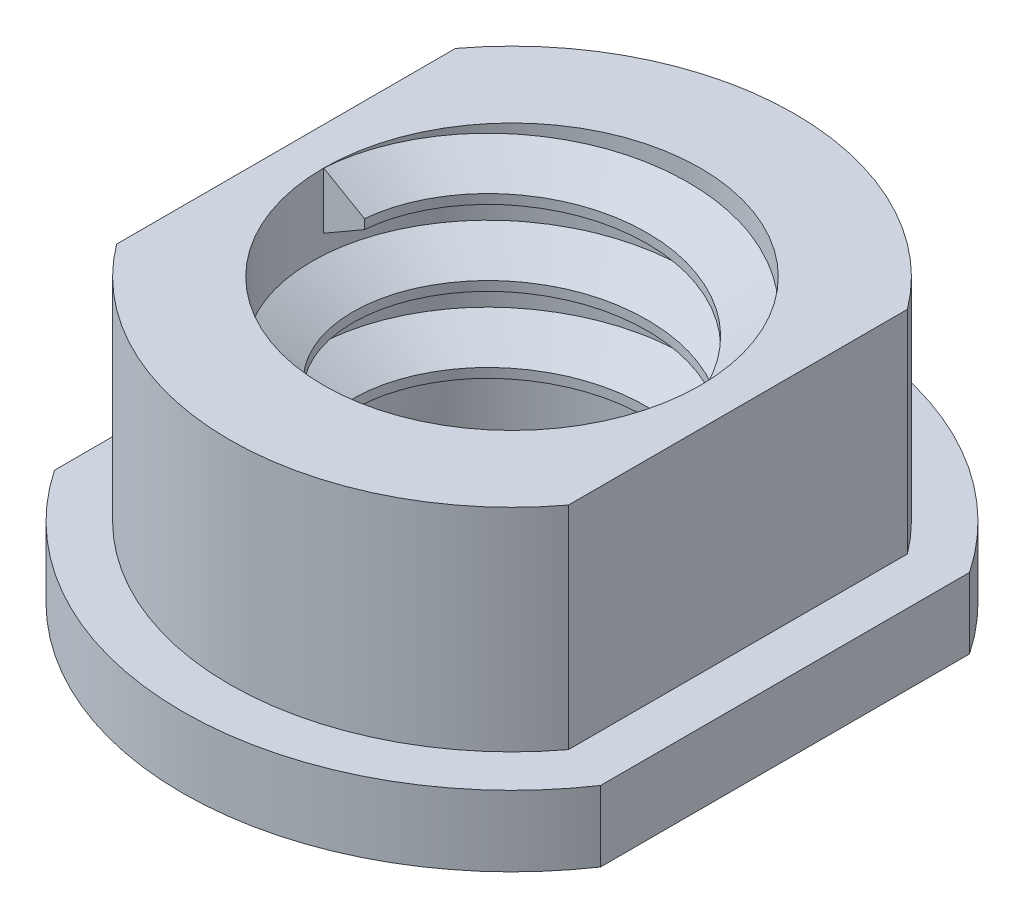
from build123d import *

# Parameters (mm, degrees)
BOSS_EXTRUDE1_DEPTH = 1.875
BOSS_EXTRUDE2_DEPTH = 11.25
SKETCH4_R           = 10
CUT_EXTRUDE1_DEPTH  = 28.230497608
THREAD1_PITCH       = 4


with BuildPart() as part:
    # Sketch1 → Boss-Extrude1 (new, symmetric)
    with BuildSketch(Plane(origin=(0, 0, 0), x_dir=(1, 0, 0), z_dir=(0, 1, 0))):
        with BuildLine():
            Line((-14.5, 9.797958971), (-14.5, -9.797958971))
            ThreePointArc((-14.5, -9.797958971), (0, -17.5), (14.5, -9.797958971))
            Line((14.5, -9.797958971), (14.5, 9.797958971))
            ThreePointArc((14.5, 9.797958971), (0, 17.5), (-14.5, 9.797958971))
        make_face()
    extrude(amount=BOSS_EXTRUDE1_DEPTH, both=True)

    # Sketch2 → Boss-Extrude2 (add)
    with BuildSketch(Plane(origin=(0, 1.875, 0), x_dir=(1, 0, 0), z_dir=(0, 1, 0))):
        with BuildLine():
            Line((12, 9), (12, -9))
            ThreePointArc((12, -9), (0, -15), (-12, -9))
            Line((-12, -9), (-12, 9))
            ThreePointArc((-12, 9), (0, 15), (12, 9))
        make_face()
    extrude(amount=BOSS_EXTRUDE2_DEPTH)

    # Sketch4 → Cut-Extrude1 (cut, through all)
    with BuildSketch(Plane(origin=(0, 13.125, 0), x_dir=(1, 0, 0), z_dir=(0, 1, 0))):
        with Locations(Location((0, 0, 0), (0, 0, 270))):
            Circle(SKETCH4_R)
    extrude(amount=-CUT_EXTRUDE1_DEPTH, mode=Mode.SUBTRACT)

    # Thread1: arcs per turn and ends read off the stored shape
    # Thread1: the profile of Thread Profile1 profile screwed along a right-hand helix through 3 turns, 12 arcs to a turn; built about Z, then put on its axis
    thread1_z = Axis((0, 0, 0), (0, 0, 1))
    thread1_corners = [(10.0003, 0, -0.000173205), (7.8349365, 0, 1.249999995), (7.8349365, 0, 1.749999995), (10.0003, 0, 3.000173194)]
    with BuildLine(mode=Mode.PRIVATE) as thread1_profile:
        Line(thread1_corners[0], thread1_corners[1])
        Line(thread1_corners[1], thread1_corners[2])
        Line(thread1_corners[2], thread1_corners[3])
        Line(thread1_corners[3], thread1_corners[0])
    thread1_cap = Face(thread1_profile.wire())
    thread1_turn_angles = [0, 15, 30, 45, 60, 75, 90, 105, 120, 135, 150, 165, 180, 195, 210, 225, 240, 255, 270, 285, 300, 315, 330, 345, 360]
    thread1_turn_weights = [1, 0.9659258262890683, 1, 0.9659258262890683, 1, 0.9659258262890683, 1, 0.9659258262890683, 1, 0.9659258262890683, 1, 0.9659258262890683, 1, 0.9659258262890683, 1, 0.9659258262890683, 1, 0.9659258262890683, 1, 0.9659258262890683, 1, 0.9659258262890683, 1, 0.9659258262890683, 1]
    thread1_turn_rails = [Edge.make_bspline([Vector(p[0], p[1], 0).rotate(thread1_z, thread1_turn_angles[k]) / thread1_turn_weights[k] + Vector(0, 0, p[2] + THREAD1_PITCH * thread1_turn_angles[k] / 360) for k in range(25)], [0, 0, 0, 1, 1, 2, 2, 3, 3, 4, 4, 5, 5, 6, 6, 7, 7, 8, 8, 9, 9, 10, 10, 11, 11, 12, 12, 12], 2, thread1_turn_weights) for p in thread1_corners]
    thread1_turn_sides = [Face.make_surface_from_curves(thread1_turn_rails[p[0]], thread1_turn_rails[p[1]]) for p in [(0, 1), (1, 2), (2, 3), (3, 0)]]
    thread1 = Plane(origin=(0, 13.125, 0), x_dir=(-1, 0, 0), z_dir=(0, -1, 0)) * Solid(Shell([*[p.moved(Location((0, 0, THREAD1_PITCH * i))) for i in range(3) for p in thread1_turn_sides], thread1_cap, thread1_cap.rotate(thread1_z, 1080).moved(Location((0, 0, THREAD1_PITCH * 1080 / 360)))]))
    add(thread1)


solid = part.part
